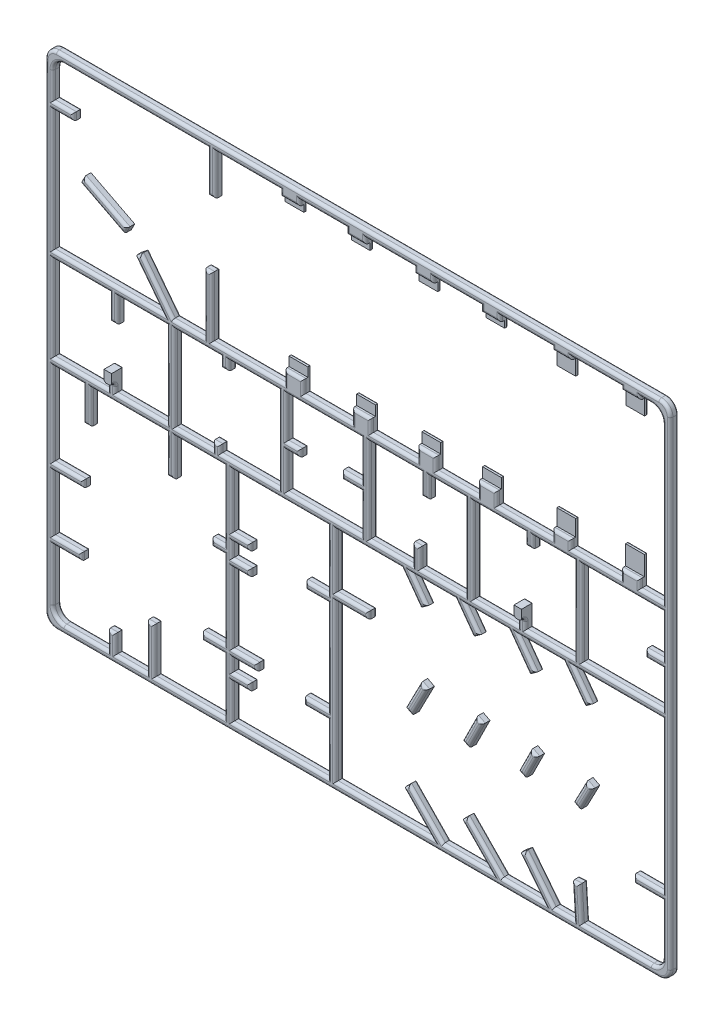
from build123d import *

# Parameters (mm, degrees)
BOSS_EXTRUDE1_DEPTH   = 2
BOSS_EXTRUDE1_2_DEPTH = 2
BOSS_EXTRUDE1_3_DEPTH = 2
BOSS_EXTRUDE1_4_DEPTH = 2
BOSS_EXTRUDE1_5_DEPTH = 2
BOSS_EXTRUDE1_6_DEPTH = 2
CUT_EXTRUDE1_START    = 0.75
CUT_EXTRUDE1_DEPTH    = 10
SKETCH5_W             = 2
SKETCH5_H             = 2.940715199
SKETCH5_H_2           = 2.796627911
BOSS_EXTRUDE2_DEPTH   = 1
FILLET1_R             = 0.75
FILLET2_R             = 0.75
FILLET3_R             = 0.75
FILLET4_R             = 0.75
FILLET5_R             = 0.75
FILLET6_R             = 0.75
FILLET7_R             = 0.25


with BuildPart() as part:
    # Sketch3 → Boss-Extrude1 (new body)
    with BuildSketch(Plane.XY):
        with BuildLine():
            ThreePointArc((-83.519314712, -63.573459525), (-82.640635056, -65.694779868), (-80.519314712, -66.573459525))
            Line((-80.519314712, -66.573459525), (79.897780038, -66.573459525))
            ThreePointArc((79.897780038, -66.573459525), (82.019100381, -65.694779868), (82.897780038, -63.573459525))
            Line((82.897780038, -63.573459525), (82.897780038, 63.862333267))
            ThreePointArc((82.897780038, 63.862333267), (82.019100381, 65.983653611), (79.897780038, 66.862333267))
            Line((79.897780038, 66.862333267), (-80.519314712, 66.862333267))
            ThreePointArc((-80.519314712, 66.862333267), (-82.640635056, 65.983653611), (-83.519314712, 63.862333267))
            Line((-83.519314712, 63.862333267), (-83.519314712, -63.573459525))
        make_face()
        with BuildLine():
            Line((-54.507957135, -52.420022945), (-56.507957135, -52.420022945))
            Line((-56.507957135, -52.420022945), (-56.507957135, -64.573459525))
            Line((-56.507957135, -64.573459525), (-64.876059545, -64.573459525))
            Line((-64.876059545, -64.573459525), (-64.876059545, -59.650746196))
            Line((-64.876059545, -59.650746196), (-66.876059545, -59.650746196))
            Line((-66.876059545, -59.650746196), (-66.876059545, -64.573459525))
            Line((-66.876059545, -64.573459525), (-78.519314712, -64.573459525))
            ThreePointArc((-78.519314712, -64.573459525), (-80.640635056, -63.694779868), (-81.519314712, -61.573459525))
            Line((-81.519314712, -61.573459525), (-81.519314712, -47.458136848))
            Line((-81.519314712, -47.458136848), (-73.814974905, -47.458136848))
            Line((-73.814974905, -47.458136848), (-73.814974905, -45.458136848))
            Line((-73.814974905, -45.458136848), (-81.519314712, -45.458136848))
            Line((-81.519314712, -45.458136848), (-81.519314712, -30.419586985))
            Line((-81.519314712, -30.419586985), (-73.273132618, -30.419586985))
            Line((-73.273132618, -30.419586985), (-73.273132618, -28.419586985))
            Line((-73.273132618, -28.419586985), (-81.519314712, -28.419586985))
            Line((-81.519314712, -28.419586985), (-81.519314712, -6.240984201))
            Line((-81.519314712, -6.240984201), (-73.438463762, -6.240984201))
            Line((-73.438463762, -6.240984201), (-73.438463762, -15.316604107))
            Line((-73.438463762, -15.316604107), (-71.438463762, -15.316604107))
            Line((-71.438463762, -15.316604107), (-71.438463762, -6.240984201))
            Line((-71.438463762, -6.240984201), (-51.104480356, -6.240984201))
            Line((-51.104480356, -6.240984201), (-51.104480356, -16.319749867))
            Line((-51.104480356, -16.319749867), (-49.104480356, -16.319749867))
            Line((-49.104480356, -16.319749867), (-49.104480356, -6.240984201))
            Line((-49.104480356, -6.240984201), (-35.828838226, -6.240984201))
            Line((-35.828838226, -6.240984201), (-35.828838226, -24.711833144))
            Line((-35.828838226, -24.711833144), (-39.262713101, -24.711833144))
            Line((-39.262713101, -24.711833144), (-39.262713101, -26.711833144))
            Line((-39.262713101, -26.711833144), (-35.828838226, -26.711833144))
            Line((-35.828838226, -26.711833144), (-35.828838226, -47.676363199))
            Line((-35.828838226, -47.676363199), (-41.871948211, -47.676363199))
            Line((-41.871948211, -47.676363199), (-41.871948211, -49.676363199))
            Line((-41.871948211, -49.676363199), (-35.828838226, -49.676363199))
            Line((-35.828838226, -49.676363199), (-35.828838226, -64.573459525))
            Line((-35.828838226, -64.573459525), (-54.507957135, -64.573459525))
            Line((-54.507957135, -64.573459525), (-54.507957135, -52.420022945))
        make_face(mode=Mode.SUBTRACT)
        Polygon((-8.23833454, -64.573459525), (-33.828838226, -64.573459525), (-33.828838226, -55.141054483), (-28.941278367, -55.141054483), (-28.941278367, -53.141054483), (-33.828838226, -53.141054483), (-33.828838226, -49.676363199), (-27.104325563, -49.676363199), (-27.104325563, -47.676363199), (-33.828838226, -47.676363199), (-33.828838226, -28.813247753), (-28.941278367, -28.813247753), (-28.941278367, -26.813247753), (-33.828838226, -26.813247753), (-33.828838226, -22.886466611), (-28.941278367, -22.886466611), (-28.941278367, -20.886466611), (-33.828838226, -20.886466611), (-33.828838226, -6.240984201), (-8.23833454, -6.240984201), (-8.23833454, -22.107891293), (-14.256524836, -22.107891293), (-14.256524836, -24.107891293), (-8.23833454, -24.107891293), (-8.23833454, -49.053005999), (-14.605599143, -49.053005999), (-14.605599143, -51.053005999), (-8.23833454, -51.053005999), align=None, mode=Mode.SUBTRACT)
        with BuildLine():
            Line((73.172328231, -46.173106445), (73.172328231, -48.173106445))
            Line((73.172328231, -48.173106445), (80.897780038, -48.173106445))
            Line((80.897780038, -48.173106445), (80.897780038, -61.573459525))
            ThreePointArc((80.897780038, -61.573459525), (80.019100381, -63.694779868), (77.897780038, -64.573459525))
            Line((77.897780038, -64.573459525), (59.305896037, -64.573459525))
            Line((59.305896037, -64.573459525), (58.742326061, -55.715397293))
            Line((58.742326061, -55.715397293), (56.746361606, -55.842385071))
            Line((56.746361606, -55.842385071), (57.301852333, -64.573459525))
            Line((57.301852333, -64.573459525), (51.809111543, -64.573459525))
            Line((51.809111543, -64.573459525), (44.409070671, -55.160841787))
            Line((44.409070671, -55.160841787), (42.83679214, -56.396940577))
            Line((42.83679214, -56.396940577), (49.265033049, -64.573459525))
            Line((49.265033049, -64.573459525), (38.048947985, -64.573459525))
            Line((38.048947985, -64.573459525), (28.790850061, -55.080688737))
            Line((28.790850061, -55.080688737), (27.359049312, -56.477093627))
            Line((27.359049312, -56.477093627), (35.255263177, -64.573459525))
            Line((35.255263177, -64.573459525), (22.301143858, -64.573459525))
            Line((22.301143858, -64.573459525), (13.331953039, -55.376919015))
            Line((13.331953039, -55.376919015), (11.90015229, -56.773323904))
            Line((11.90015229, -56.773323904), (19.507459051, -64.573459525))
            Line((19.507459051, -64.573459525), (-6.23833454, -64.573459525))
            Line((-6.23833454, -64.573459525), (-6.23833454, -22.886466611))
            Line((-6.23833454, -22.886466611), (2.517730657, -22.886466611))
            Line((2.517730657, -22.886466611), (2.517730657, -20.886466611))
            Line((2.517730657, -20.886466611), (-6.23833454, -20.886466611))
            Line((-6.23833454, -20.886466611), (-6.23833454, -6.240984201))
            Line((-6.23833454, -6.240984201), (11.418024461, -6.240984201))
            Line((11.418024461, -6.240984201), (16.415870407, -13.123531529))
            Line((16.415870407, -13.123531529), (18.034197004, -11.948363871))
            Line((18.034197004, -11.948363871), (13.88971343, -6.240984201))
            Line((13.88971343, -6.240984201), (25.688198823, -6.240984201))
            Line((25.688198823, -6.240984201), (30.443837347, -12.789987024))
            Line((30.443837347, -12.789987024), (32.062163944, -11.614819366))
            Line((32.062163944, -11.614819366), (28.159887793, -6.240984201))
            Line((28.159887793, -6.240984201), (39.848961122, -6.240984201))
            Line((39.848961122, -6.240984201), (45.4438614, -13.945736683))
            Line((45.4438614, -13.945736683), (47.062187998, -12.770569025))
            Line((47.062187998, -12.770569025), (42.320650091, -6.240984201))
            Line((42.320650091, -6.240984201), (54.506593956, -6.240984201))
            Line((54.506593956, -6.240984201), (60.15216236, -13.949039604))
            Line((60.15216236, -13.949039604), (61.765671392, -12.767266104))
            Line((61.765671392, -12.767266104), (56.985662819, -6.240984201))
            Line((56.985662819, -6.240984201), (80.897780038, -6.240984201))
            Line((80.897780038, -6.240984201), (80.897780038, -46.173106445))
            Line((80.897780038, -46.173106445), (73.172328231, -46.173106445))
        make_face(mode=Mode.SUBTRACT)
        Polygon((-66.352374221, 11.740312755), (-64.352374221, 11.740312755), (-64.352374221, 18.457447133), (-51.104480356, 18.457447133), (-51.104480356, -4.240984201), (-64.876059545, -4.240984201), (-64.876059545, 0.871466259), (-66.876059545, 0.871466259), (-66.876059545, -4.240984201), (-81.519314712, -4.240984201), (-81.519314712, 18.457447133), (-66.352374221, 18.457447133), align=None, mode=Mode.SUBTRACT)
        Polygon((-36.769306967, 18.457447133), (-36.769306967, 15.795175965), (-34.769306967, 15.795175965), (-34.769306967, 18.457447133), (-21.352881347, 18.457447133), (-21.352881347, -4.240984201), (-36.949642774, -4.240984201), (-36.949642774, -2.200002897), (-38.949642774, -2.200002897), (-38.949642774, -4.240984201), (-49.104480356, -4.240984201), (-49.104480356, 18.457447133), align=None, mode=Mode.SUBTRACT)
        Polygon((0.670333987, -4.240984201), (-19.352881347, -4.240984201), (-19.352881347, 5.409946313), (-15.671871189, 5.409946313), (-15.671871189, 7.409946313), (-19.352881347, 7.409946313), (-19.352881347, 18.457447133), (0.670333987, 18.457447133), (0.670333987, 8.108231466), (-4.567004912, 8.108231466), (-4.567004912, 6.108231466), (0.670333987, 6.108231466), align=None, mode=Mode.SUBTRACT)
        Polygon((14.291240949, -4.240984201), (2.670333987, -4.240984201), (2.670333987, 18.457447133), (16.591546265, 18.457447133), (16.591546265, 12.890249838), (18.591546265, 12.890249838), (18.591546265, 18.457447133), (28.363232015, 18.457447133), (28.363232015, -4.240984201), (16.291240949, -4.240984201), (16.291240949, 0.871466259), (14.291240949, 0.871466259), align=None, mode=Mode.SUBTRACT)
        Polygon((44.356571704, 18.457447133), (44.356571704, 15.341646321), (46.356571704, 15.341646321), (46.356571704, 18.457447133), (57.367496449, 18.457447133), (57.367496449, -4.240984201), (44.305864114, -4.240984201), (44.305864114, 1.11186894), (42.305864114, 1.11186894), (42.305864114, -4.240984201), (30.363232015, -4.240984201), (30.363232015, 18.457447133), align=None, mode=Mode.SUBTRACT)
        Polygon((80.897780038, 5.409946313), (80.897780038, -4.240984201), (59.367496449, -4.240984201), (59.367496449, 18.457447133), (80.897780038, 18.457447133), (80.897780038, 7.409946313), (76.343280176, 7.409946313), (76.343280176, 5.409946313), align=None, mode=Mode.SUBTRACT)
        with BuildLine():
            Line((80.897780038, 61.862333267), (80.897780038, 20.457447133))
            Line((80.897780038, 20.457447133), (74.790620634, 20.457447133))
            Line((74.790620634, 20.457447133), (74.790620634, 27.861226693))
            Line((74.790620634, 27.861226693), (69.790620634, 27.861226693))
            Line((69.790620634, 27.861226693), (69.790620634, 20.457447133))
            Line((69.790620634, 20.457447133), (56.490178798, 20.457447133))
            Line((56.490178798, 20.457447133), (56.490178798, 27.012376091))
            Line((56.490178798, 27.012376091), (51.490178798, 27.012376091))
            Line((51.490178798, 27.012376091), (51.490178798, 20.457447133))
            Line((51.490178798, 20.457447133), (36.687493252, 20.457447133))
            Line((36.687493252, 20.457447133), (36.687493252, 26.561417494))
            Line((36.687493252, 26.561417494), (31.687493252, 26.561417494))
            Line((31.687493252, 26.561417494), (31.687493252, 20.457447133))
            Line((31.687493252, 20.457447133), (20.555720119, 20.457447133))
            Line((20.555720119, 20.457447133), (20.555720119, 26.561417494))
            Line((20.555720119, 26.561417494), (15.555720119, 26.561417494))
            Line((15.555720119, 26.561417494), (15.555720119, 20.457447133))
            Line((15.555720119, 20.457447133), (3.174810137, 20.457447133))
            Line((3.174810137, 20.457447133), (3.174810137, 26.561417494))
            Line((3.174810137, 26.561417494), (-1.825189863, 26.561417494))
            Line((-1.825189863, 26.561417494), (-1.825189863, 20.457447133))
            Line((-1.825189863, 20.457447133), (-14.827882291, 20.457447133))
            Line((-14.827882291, 20.457447133), (-14.827882291, 26.315097408))
            Line((-14.827882291, 26.315097408), (-19.827882291, 26.315097408))
            Line((-19.827882291, 26.315097408), (-19.827882291, 20.457447133))
            Line((-19.827882291, 20.457447133), (-39.165803603, 20.457447133))
            Line((-39.165803603, 20.457447133), (-39.165803603, 36.417121741))
            Line((-39.165803603, 36.417121741), (-41.165803603, 36.417121741))
            Line((-41.165803603, 36.417121741), (-41.165803603, 20.457447133))
            Line((-41.165803603, 20.457447133), (-49.613507595, 20.457447133))
            Line((-49.613507595, 20.457447133), (-58.037306471, 31.356396888))
            Line((-58.037306471, 31.356396888), (-59.619744177, 30.133330697))
            Line((-59.619744177, 30.133330697), (-52.141253228, 20.457447133))
            Line((-52.141253228, 20.457447133), (-81.519314712, 20.457447133))
            Line((-81.519314712, 20.457447133), (-81.519314712, 52.854637304))
            Line((-81.519314712, 52.854637304), (-75.982827986, 52.854637304))
            Line((-75.982827986, 52.854637304), (-75.982827986, 54.854637304))
            Line((-75.982827986, 54.854637304), (-81.519314712, 54.854637304))
            Line((-81.519314712, 54.854637304), (-81.519314712, 61.862333267))
            ThreePointArc((-81.519314712, 61.862333267), (-80.640635056, 63.983653611), (-78.519314712, 64.862333267))
            Line((-78.519314712, 64.862333267), (-40.262713101, 64.862333267))
            Line((-40.262713101, 64.862333267), (-40.262713101, 53.854637304))
            Line((-40.262713101, 53.854637304), (-38.262713101, 53.854637304))
            Line((-38.262713101, 53.854637304), (-38.262713101, 64.862333267))
            Line((-38.262713101, 64.862333267), (-20.89451971, 64.862333267))
            Line((-20.89451971, 64.862333267), (-20.89451971, 61.429375725))
            Line((-20.89451971, 61.429375725), (-15.89451971, 61.429375725))
            Line((-15.89451971, 61.429375725), (-15.89451971, 64.862333267))
            Line((-15.89451971, 64.862333267), (-3.273128242, 64.862333267))
            Line((-3.273128242, 64.862333267), (-3.273128242, 61.429375725))
            Line((-3.273128242, 61.429375725), (1.726871758, 61.429375725))
            Line((1.726871758, 61.429375725), (1.726871758, 64.862333267))
            Line((1.726871758, 64.862333267), (14.767820166, 64.862333267))
            Line((14.767820166, 64.862333267), (14.767820166, 60.957225524))
            Line((14.767820166, 60.957225524), (19.767820166, 60.957225524))
            Line((19.767820166, 60.957225524), (19.767820166, 64.862333267))
            Line((19.767820166, 64.862333267), (32.548978708, 64.862333267))
            Line((32.548978708, 64.862333267), (32.548978708, 61.429375725))
            Line((32.548978708, 61.429375725), (37.548978708, 61.429375725))
            Line((37.548978708, 61.429375725), (37.548978708, 64.862333267))
            Line((37.548978708, 64.862333267), (51.490178798, 64.862333267))
            Line((51.490178798, 64.862333267), (51.490178798, 59.824189276))
            Line((51.490178798, 59.824189276), (56.490178798, 59.824189276))
            Line((56.490178798, 59.824189276), (56.490178798, 64.862333267))
            Line((56.490178798, 64.862333267), (69.853511767, 64.862333267))
            Line((69.853511767, 64.862333267), (69.853511767, 59.824189276))
            Line((69.853511767, 59.824189276), (74.853511767, 59.824189276))
            Line((74.853511767, 59.824189276), (74.853511767, 64.862333267))
            Line((74.853511767, 64.862333267), (77.897780038, 64.862333267))
            ThreePointArc((77.897780038, 64.862333267), (80.019100381, 63.983653611), (80.897780038, 61.862333267))
        make_face(mode=Mode.SUBTRACT)
    extrude(amount=BOSS_EXTRUDE1_DEPTH)

    # Sketch4 → Cut-Extrude1 (cut)
    with BuildSketch(Plane.XY.offset(CUT_EXTRUDE1_START)):
        Polygon((44.141484857, 63.255744086), (44.141484857, 63.946982285), (79.151088229, 63.946982285), (79.151088229, 22.73298783), (44.141484857, 22.73298783), (44.141484857, 23.914632256), (-26.70772101, 23.914632256), (-26.70772101, 63.255744086), align=None)
    extrude(amount=CUT_EXTRUDE1_DEPTH, mode=Mode.SUBTRACT)

    # Sketch5 → Boss-Extrude2 (add)
    with BuildSketch(Plane.XY.offset(2)):
        with Locations((-65.876059545, -0.598891341)):
            Rectangle(SKETCH5_W, SKETCH5_H)
        with Locations((43.305864114, -0.286445016)):
            Rectangle(SKETCH5_W, SKETCH5_H_2)
    extrude(amount=BOSS_EXTRUDE2_DEPTH)

    # Fillet1
    fillet1_edges = [part.edges().sort_by_distance(p)[0] for p in [
        (48.413622024, -6.240984201, 2),
        (57.329378158, -10.095011903, 2),
        (60.958916876, -13.358152854, 2),
        (59.375667105, -9.504125153, 2),
        (68.941721428, -6.240984201, 2),
        (-35.769306967, 15.795175965, 2),
        (80.897780038, -26.207045323, 2),
        (77.035054134, -46.173106445, 2),
        (73.172328231, -47.173106445, 2),
        (77.035054134, -48.173106445, 2),
        (-34.769306967, 17.126311549, 2),
        (-28.061094157, 18.457447133, 2),
        (-21.352881347, 7.108231466, 2),
        (-29.15126206, -4.240984201, 2),
        (-36.949642774, -3.220493549, 2),
        (-37.949642774, -2.200002897, 2),
        (-38.949642774, -3.220493549, 2),
        (-44.027061565, -4.240984201, 2),
        (-49.104480356, 7.108231466, 2),
        (82.897780038, 0.144436871, 2),
        (36.334548065, -4.240984201, 2),
        (30.363232015, 7.108231466, 2),
        (37.359901859, 18.457447133, 2),
        (44.356571704, 16.899546727, 2),
        (45.356571704, 15.341646321, 2),
        (46.356571704, 16.899546727, 2),
        (51.862034077, 18.457447133, 2),
        (57.367496449, 7.108231466, 2),
        (82.019100381, 65.983653611, 2),
        (50.836680282, -4.240984201, 2),
        (80.897780038, 0.584481056, 2),
        (70.132638244, -4.240984201, 2),
        (59.367496449, 7.108231466, 2),
        (70.132638244, 18.457447133, 2),
        (80.897780038, 12.933696723, 2),
        (78.620530107, 7.409946313, 2),
        (76.343280176, 6.409946313, 2),
        (78.620530107, 5.409946313, 2),
        (-0.310767337, 66.862333267, 2),
        (-66.876059545, -3.15511657, 2),
        (-74.197687129, -4.240984201, 2),
        (-81.519314712, 7.108231466, 2),
        (-73.935844467, 18.457447133, 2),
        (-66.352374221, 15.098879944, 2),
        (-65.352374221, 11.740312755, 2),
        (-64.352374221, 15.098879944, 2),
        (-57.728427288, 18.457447133, 2),
        (-51.104480356, 7.108231466, 2),
        (-57.99026995, -4.240984201, 2),
        (-82.640635056, 65.983653611, 2),
        (-64.876059545, -3.15511657, 2),
        (14.291240949, -1.684758971, 2),
        (8.480787468, -4.240984201, 2),
        (2.670333987, 7.108231466, 2),
        (9.630940126, 18.457447133, 2),
        (16.591546265, 15.673848486, 2),
        (17.591546265, 12.890249838, 2),
        (18.591546265, 15.673848486, 2),
        (23.47738914, 18.457447133, 2),
        (-83.519314712, 0.144436871, 2),
        (28.363232015, 7.108231466, 2),
        (22.327236482, -4.240984201, 2),
        (16.291240949, -1.684758971, 2),
        (15.291240949, 0.871466259, 2),
        (-31.385058296, -20.886466611, 2),
        (-33.828838226, -13.563725406, 2),
        (-21.033586383, -6.240984201, 2),
        (-8.23833454, -14.174437747, 2),
        (-11.247429688, -22.107891293, 2),
        (-14.256524836, -23.107891293, 2),
        (-82.640635056, -65.694779868, 2),
        (-11.247429688, -24.107891293, 2),
        (-8.23833454, -36.580448646, 2),
        (-11.421966841, -49.053005999, 2),
        (-14.605599143, -50.053005999, 2),
        (-11.421966841, -51.053005999, 2),
        (-8.23833454, -57.813232762, 2),
        (-21.033586383, -64.573459525, 2),
        (-33.828838226, -59.857257004, 2),
        (-31.385058296, -55.141054483, 2),
        (-28.941278367, -54.141054483, 2),
        (-0.310767337, -66.573459525, 2),
        (-31.385058296, -53.141054483, 2),
        (-33.828838226, -51.408708841, 2),
        (-30.466581895, -49.676363199, 2),
        (-27.104325563, -48.676363199, 2),
        (-30.466581895, -47.676363199, 2),
        (-33.828838226, -38.244805476, 2),
        (-31.385058296, -28.813247753, 2),
        (-28.941278367, -27.813247753, 2),
        (-31.385058296, -26.813247753, 2),
        (-33.828838226, -24.849857182, 2),
        (82.019100381, -65.694779868, 2),
        (-31.385058296, -22.886466611, 2),
        (-28.941278367, -21.886466611, 2),
        (-72.697687129, -64.573459525, 2),
        (-80.640635056, -63.694779868, 2),
        (-81.519314712, -54.515798186, 2),
        (-77.667144809, -47.458136848, 2),
        (-73.814974905, -46.458136848, 2),
        (-77.667144809, -45.458136848, 2),
        (-81.519314712, -37.938861917, 2),
        (-77.396223665, -30.419586985, 2),
        (0.670333987, 13.2828393, 2),
        (-73.273132618, -29.419586985, 2),
        (-77.396223665, -28.419586985, 2),
        (-81.519314712, -17.330285593, 2),
        (-77.478889237, -6.240984201, 2),
        (-73.438463762, -10.778794154, 2),
        (-72.438463762, -15.316604107, 2),
        (-71.438463762, -10.778794154, 2),
        (-61.271472059, -6.240984201, 2),
        (-51.104480356, -11.280367034, 2),
        (-50.104480356, -16.319749867, 2),
        (-1.948335463, 8.108231466, 2),
        (-49.104480356, -11.280367034, 2),
        (-42.466659291, -6.240984201, 2),
        (-35.828838226, -15.476408672, 2),
        (-37.545775664, -24.711833144, 2),
        (-39.262713101, -25.711833144, 2),
        (-37.545775664, -26.711833144, 2),
        (-35.828838226, -37.194098171, 2),
        (-38.850393218, -47.676363199, 2),
        (-41.871948211, -48.676363199, 2),
        (-38.850393218, -49.676363199, 2),
        (-4.567004912, 7.108231466, 2),
        (-35.828838226, -57.124911362, 2),
        (-45.16839768, -64.573459525, 2),
        (-54.507957135, -58.496741235, 2),
        (-55.507957135, -52.420022945, 2),
        (-56.507957135, -58.496741235, 2),
        (-60.69200834, -64.573459525, 2),
        (-64.876059545, -62.11210286, 2),
        (-65.876059545, -59.650746196, 2),
        (-66.876059545, -62.11210286, 2),
        (80.019100381, 63.983653611, 2),
        (-1.948335463, 6.108231466, 2),
        (80.897780038, 41.1598902, 2),
        (77.844200336, 20.457447133, 2),
        (63.140399716, 20.457447133, 2),
        (56.490178798, 21.595217482, 2),
        (51.490178798, 21.595217482, 2),
        (44.088836025, 20.457447133, 2),
        (0.670333987, 0.933623632, 2),
        (26.121606685, 20.457447133, 2),
        (9.365265128, 20.457447133, 2),
        (-9.34127368, -4.240984201, 2),
        (-8.326536077, 20.457447133, 2),
        (-29.496842947, 20.457447133, 2),
        (-39.165803603, 28.437284437, 2),
        (-40.165803603, 36.417121741, 2),
        (-41.165803603, 28.437284437, 2),
        (-45.389655599, 20.457447133, 2),
        (-19.352881347, 0.584481056, 2),
        (74.790620634, 21.595217482, 2),
        (69.790620634, 21.595217482, 2),
        (36.687493252, 22.186039695, 2),
        (31.687493252, 22.186039695, 2),
        (20.555720119, 22.186039695, 2),
        (15.555720119, 22.186039695, 2),
        (3.174810137, 22.186039695, 2),
        (-1.825189863, 22.186039695, 2),
        (-53.825407033, 25.906922011, 2),
        (-14.827882291, 22.186039695, 2),
        (-19.827882291, 22.186039695, 2),
        (-20.89451971, 64.059038676, 2),
        (-15.89451971, 64.059038676, 2),
        (-3.273128242, 64.059038676, 2),
        (1.726871758, 64.059038676, 2),
        (14.767820166, 64.059038676, 2),
        (19.767820166, 64.059038676, 2),
        (32.548978708, 64.059038676, 2),
        (37.548978708, 64.059038676, 2),
        (51.490178798, 64.404657776, 2),
        (56.490178798, 64.404657776, 2),
        (69.853511767, 64.404657776, 2),
        (74.853511767, 64.404657776, 2),
        (-58.828525324, 30.744863792, 2),
        (35.048978708, 63.255744086, 2),
        (17.267820166, 63.255744086, 2),
        (-0.773128242, 63.255744086, 2),
        (-18.39451971, 63.255744086, 2),
        (72.353511767, 63.946982285, 2),
        (53.990178798, 63.946982285, 2),
        (53.990178798, 22.73298783, 2),
        (72.290620634, 22.73298783, 2),
        (-17.327882291, 23.914632256, 2),
        (-55.880498702, 25.295388915, 2),
        (0.674810137, 23.914632256, 2),
        (18.055720119, 23.914632256, 2),
        (34.187493252, 23.914632256, 2),
        (-66.83028397, 20.457447133, 2),
        (-81.519314712, 36.656042219, 2),
        (-78.751071349, 52.854637304, 2),
        (-75.982827986, 53.854637304, 2),
        (-78.751071349, 54.854637304, 2),
        (-81.519314712, 58.358485286, 2),
        (-80.640635056, 63.983653611, 2),
        (-17.512376268, 5.409946313, 2),
        (-59.391013907, 64.862333267, 2),
        (-40.262713101, 59.358485286, 2),
        (-39.262713101, 53.854637304, 2),
        (-38.262713101, 59.358485286, 2),
        (-29.578616405, 64.862333267, 2),
        (-9.583823976, 64.862333267, 2),
        (-15.671871189, 6.409946313, 2),
        (8.247345962, 64.862333267, 2),
        (26.158399437, 64.862333267, 2),
        (-17.512376268, 7.409946313, 2),
        (-64.876059545, -2.06924894, 2.5),
        (44.519578753, 64.862333267, 2),
        (-65.876059545, -2.06924894, 2),
        (-66.876059545, -2.06924894, 2.5),
        (44.305864114, -2.962871586, 2),
        (42.305864114, -2.962871586, 2),
        (43.305864114, -1.684758971, 2),
        (42.305864114, -1.684758971, 2.5),
        (44.305864114, -1.684758971, 2.5),
        (63.171845282, 64.862333267, 2),
        (76.375645902, 64.862333267, 2),
        (80.897780038, -54.873282985, 2),
        (-19.352881347, 12.933696723, 2),
        (80.019100381, -63.694779868, 2),
        (68.601838038, -64.573459525, 2),
        (59.024111049, -60.144428409, 2),
        (57.744343834, -55.778891182, 2),
        (57.02410697, -60.207922298, 2),
        (54.555481938, -64.573459525, 2),
        (48.109091107, -59.867150656, 2),
        (43.622931406, -55.778891182, 2),
        (46.050912594, -60.485200051, 2),
        (43.656990517, -64.573459525, 2),
        (-9.34127368, 18.457447133, 2),
        (33.419899023, -59.827074131, 2),
        (28.074949687, -55.778891182, 2),
        (31.307156245, -60.525276576, 2),
        (28.778203518, -64.573459525, 2),
        (17.816548449, -59.97518927, 2),
        (12.616052664, -56.075121459, 2),
        (15.70380567, -60.673391714, 2),
        (6.634562255, -64.573459525, 2),
        (-6.23833454, -43.729963068, 2),
        (-1.860301942, -22.886466611, 2),
        (-42.936893661, 18.457447133, 2),
        (2.517730657, -21.886466611, 2),
        (-1.860301942, -20.886466611, 2),
        (-6.23833454, -13.563725406, 2),
        (2.58984496, -6.240984201, 2),
        (13.916947434, -9.682257865, 2),
        (17.225033706, -12.5359477, 2),
        (15.961955217, -9.094674036, 2),
        (19.788956127, -6.240984201, 2),
        (28.066018085, -9.515485613, 2),
        (31.253000645, -12.202403195, 2),
        (-36.769306967, 17.126311549, 2),
        (30.111025868, -8.927901784, 2),
        (34.004424457, -6.240984201, 2),
        (42.646411261, -10.093360442, 2),
        (46.253024699, -13.358152854, 2),
        (44.691419045, -9.505776613, 2),
    ]]
    fillet(fillet1_edges, radius=FILLET1_R)

    # Fillet7
    fillet7_edges = [part.edges().sort_by_distance(p)[0] for p in [
        (77.035054134, -48.173106445, 0),
        (73.172328231, -47.173106445, 0),
        (77.035054134, -46.173106445, 0),
        (80.897780038, -26.207045323, 0),
        (68.941721428, -6.240984201, 0),
        (59.375667105, -9.504125153, 0),
        (60.958916876, -13.358152854, 0),
        (57.329378158, -10.095011903, 0),
        (48.413622024, -6.240984201, 0),
        (44.691419045, -9.505776613, 0),
        (46.253024699, -13.358152854, 0),
        (42.646411261, -10.093360442, 0),
        (34.004424457, -6.240984201, 0),
        (30.111025868, -8.927901784, 0),
        (31.253000645, -12.202403195, 0),
        (28.066018085, -9.515485613, 0),
        (19.788956127, -6.240984201, 0),
        (15.961955217, -9.094674036, 0),
        (17.225033706, -12.5359477, 0),
        (13.916947434, -9.682257865, 0),
        (2.58984496, -6.240984201, 0),
        (-6.23833454, -13.563725406, 0),
        (-1.860301942, -20.886466611, 0),
        (2.517730657, -21.886466611, 0),
        (-1.860301942, -22.886466611, 0),
        (-6.23833454, -43.729963068, 0),
        (6.634562255, -64.573459525, 0),
        (15.70380567, -60.673391714, 0),
        (12.616052664, -56.075121459, 0),
        (17.816548449, -59.97518927, 0),
        (28.778203518, -64.573459525, 0),
        (31.307156245, -60.525276576, 0),
        (28.074949687, -55.778891182, 0),
        (33.419899023, -59.827074131, 0),
        (43.656990517, -64.573459525, 0),
        (46.050912594, -60.485200051, 0),
        (43.622931406, -55.778891182, 0),
        (48.109091107, -59.867150656, 0),
        (54.555481938, -64.573459525, 0),
        (57.02410697, -60.207922298, 0),
        (57.744343834, -55.778891182, 0),
        (59.024111049, -60.144428409, 0),
        (68.601838038, -64.573459525, 0),
        (80.019100381, -63.694779868, 0),
        (80.897780038, -54.873282985, 0),
        (76.375645902, 64.862333267, 0),
        (74.853511767, 62.343261272, 0),
        (72.353511767, 59.824189276, 0),
        (69.853511767, 62.343261272, 0),
        (63.171845282, 64.862333267, 0),
        (56.490178798, 62.343261272, 0),
        (53.990178798, 59.824189276, 0),
        (51.490178798, 62.343261272, 0),
        (44.519578753, 64.862333267, 0),
        (37.548978708, 63.145854496, 0),
        (35.048978708, 61.429375725, 0),
        (32.548978708, 63.145854496, 0),
        (26.158399437, 64.862333267, 0),
        (19.767820166, 62.909779396, 0),
        (17.267820166, 60.957225524, 0),
        (14.767820166, 62.909779396, 0),
        (8.247345962, 64.862333267, 0),
        (1.726871758, 63.145854496, 0),
        (-0.773128242, 61.429375725, 0),
        (-3.273128242, 63.145854496, 0),
        (-9.583823976, 64.862333267, 0),
        (-15.89451971, 63.145854496, 0),
        (-18.39451971, 61.429375725, 0),
        (-20.89451971, 63.145854496, 0),
        (-29.578616405, 64.862333267, 0),
        (-38.262713101, 59.358485286, 0),
        (-39.262713101, 53.854637304, 0),
        (-40.262713101, 59.358485286, 0),
        (-59.391013907, 64.862333267, 0),
        (-80.640635056, 63.983653611, 0),
        (-81.519314712, 58.358485286, 0),
        (-78.751071349, 54.854637304, 0),
        (-75.982827986, 53.854637304, 0),
        (-78.751071349, 52.854637304, 0),
        (-81.519314712, 36.656042219, 0),
        (-66.83028397, 20.457447133, 0),
        (-55.880498702, 25.295388915, 0),
        (-58.828525324, 30.744863792, 0),
        (-53.825407033, 25.906922011, 0),
        (-45.389655599, 20.457447133, 0),
        (-41.165803603, 28.437284437, 0),
        (-40.165803603, 36.417121741, 0),
        (-39.165803603, 28.437284437, 0),
        (-29.496842947, 20.457447133, 0),
        (-19.827882291, 23.386272271, 0),
        (-17.327882291, 26.315097408, 0),
        (-14.827882291, 23.386272271, 0),
        (-8.326536077, 20.457447133, 0),
        (-1.825189863, 23.509432314, 0),
        (0.674810137, 26.561417494, 0),
        (3.174810137, 23.509432314, 0),
        (9.365265128, 20.457447133, 0),
        (15.555720119, 23.509432314, 0),
        (18.055720119, 26.561417494, 0),
        (20.555720119, 23.509432314, 0),
        (26.121606685, 20.457447133, 0),
        (31.687493252, 23.509432314, 0),
        (34.187493252, 26.561417494, 0),
        (36.687493252, 23.509432314, 0),
        (44.088836025, 20.457447133, 0),
        (51.490178798, 23.734911612, 0),
        (53.990178798, 27.012376091, 0),
        (56.490178798, 23.734911612, 0),
        (63.140399716, 20.457447133, 0),
        (69.790620634, 24.159336913, 0),
        (72.290620634, 27.861226693, 0),
        (74.790620634, 24.159336913, 0),
        (77.844200336, 20.457447133, 0),
        (80.897780038, 41.1598902, 0),
        (80.019100381, 63.983653611, 0),
        (-66.876059545, -62.11210286, 0),
        (-65.876059545, -59.650746196, 0),
        (-64.876059545, -62.11210286, 0),
        (-60.69200834, -64.573459525, 0),
        (-56.507957135, -58.496741235, 0),
        (-55.507957135, -52.420022945, 0),
        (-54.507957135, -58.496741235, 0),
        (-45.16839768, -64.573459525, 0),
        (-35.828838226, -57.124911362, 0),
        (-38.850393218, -49.676363199, 0),
        (-41.871948211, -48.676363199, 0),
        (-38.850393218, -47.676363199, 0),
        (-35.828838226, -37.194098171, 0),
        (-37.545775664, -26.711833144, 0),
        (-39.262713101, -25.711833144, 0),
        (-37.545775664, -24.711833144, 0),
        (-35.828838226, -15.476408672, 0),
        (-42.466659291, -6.240984201, 0),
        (-49.104480356, -11.280367034, 0),
        (-50.104480356, -16.319749867, 0),
        (-51.104480356, -11.280367034, 0),
        (-61.271472059, -6.240984201, 0),
        (-71.438463762, -10.778794154, 0),
        (-72.438463762, -15.316604107, 0),
        (-73.438463762, -10.778794154, 0),
        (-77.478889237, -6.240984201, 0),
        (-81.519314712, -17.330285593, 0),
        (-77.396223665, -28.419586985, 0),
        (-73.273132618, -29.419586985, 0),
        (-77.396223665, -30.419586985, 0),
        (-81.519314712, -37.938861917, 0),
        (-77.667144809, -45.458136848, 0),
        (-73.814974905, -46.458136848, 0),
        (-77.667144809, -47.458136848, 0),
        (-81.519314712, -54.515798186, 0),
        (-80.640635056, -63.694779868, 0),
        (-72.697687129, -64.573459525, 0),
        (-28.941278367, -21.886466611, 0),
        (-31.385058296, -22.886466611, 0),
        (-33.828838226, -24.849857182, 0),
        (-31.385058296, -26.813247753, 0),
        (-28.941278367, -27.813247753, 0),
        (-31.385058296, -28.813247753, 0),
        (-33.828838226, -38.244805476, 0),
        (-30.466581895, -47.676363199, 0),
        (-27.104325563, -48.676363199, 0),
        (-30.466581895, -49.676363199, 0),
        (-33.828838226, -51.408708841, 0),
        (-31.385058296, -53.141054483, 0),
        (-28.941278367, -54.141054483, 0),
        (-31.385058296, -55.141054483, 0),
        (-33.828838226, -59.857257004, 0),
        (-21.033586383, -64.573459525, 0),
        (-8.23833454, -57.813232762, 0),
        (-11.421966841, -51.053005999, 0),
        (-14.605599143, -50.053005999, 0),
        (-11.421966841, -49.053005999, 0),
        (-8.23833454, -36.580448646, 0),
        (-11.247429688, -24.107891293, 0),
        (-14.256524836, -23.107891293, 0),
        (-11.247429688, -22.107891293, 0),
        (-8.23833454, -14.174437747, 0),
        (-21.033586383, -6.240984201, 0),
        (-33.828838226, -13.563725406, 0),
        (-31.385058296, -20.886466611, 0),
        (15.291240949, 0.871466259, 0),
        (16.291240949, -1.684758971, 0),
        (22.327236482, -4.240984201, 0),
        (28.363232015, 7.108231466, 0),
        (23.47738914, 18.457447133, 0),
        (18.591546265, 15.673848486, 0),
        (17.591546265, 12.890249838, 0),
        (16.591546265, 15.673848486, 0),
        (9.630940126, 18.457447133, 0),
        (2.670333987, 7.108231466, 0),
        (8.480787468, -4.240984201, 0),
        (14.291240949, -1.684758971, 0),
        (-65.876059545, 0.871466259, 0),
        (-64.876059545, -1.684758971, 0),
        (-57.99026995, -4.240984201, 0),
        (-51.104480356, 7.108231466, 0),
        (-57.728427288, 18.457447133, 0),
        (-64.352374221, 15.098879944, 0),
        (-65.352374221, 11.740312755, 0),
        (-66.352374221, 15.098879944, 0),
        (-73.935844467, 18.457447133, 0),
        (-81.519314712, 7.108231466, 0),
        (-74.197687129, -4.240984201, 0),
        (-66.876059545, -1.684758971, 0),
        (78.620530107, 5.409946313, 0),
        (76.343280176, 6.409946313, 0),
        (78.620530107, 7.409946313, 0),
        (80.897780038, 12.933696723, 0),
        (70.132638244, 18.457447133, 0),
        (59.367496449, 7.108231466, 0),
        (70.132638244, -4.240984201, 0),
        (80.897780038, 0.584481056, 0),
        (44.305864114, -1.564557631, 0),
        (50.836680282, -4.240984201, 0),
        (57.367496449, 7.108231466, 0),
        (51.862034077, 18.457447133, 0),
        (46.356571704, 16.899546727, 0),
        (45.356571704, 15.341646321, 0),
        (44.356571704, 16.899546727, 0),
        (37.359901859, 18.457447133, 0),
        (30.363232015, 7.108231466, 0),
        (36.334548065, -4.240984201, 0),
        (42.305864114, -1.564557631, 0),
        (43.305864114, 1.11186894, 0),
        (-49.104480356, 7.108231466, 0),
        (-44.027061565, -4.240984201, 0),
        (-38.949642774, -3.220493549, 0),
        (-37.949642774, -2.200002897, 0),
        (-36.949642774, -3.220493549, 0),
        (-29.15126206, -4.240984201, 0),
        (-21.352881347, 7.108231466, 0),
        (-28.061094157, 18.457447133, 0),
        (-34.769306967, 17.126311549, 0),
        (-35.769306967, 15.795175965, 0),
        (-36.769306967, 17.126311549, 0),
        (-42.936893661, 18.457447133, 0),
        (-9.34127368, 18.457447133, 0),
        (-19.352881347, 12.933696723, 0),
        (-17.512376268, 7.409946313, 0),
        (-15.671871189, 6.409946313, 0),
        (-17.512376268, 5.409946313, 0),
        (-19.352881347, 0.584481056, 0),
        (-9.34127368, -4.240984201, 0),
        (0.670333987, 0.933623632, 0),
        (-1.948335463, 6.108231466, 0),
        (-4.567004912, 7.108231466, 0),
        (-1.948335463, 8.108231466, 0),
        (0.670333987, 13.2828393, 0),
        (82.019100381, -65.694779868, 0),
        (-0.310767337, -66.573459525, 0),
        (-82.640635056, -65.694779868, 0),
        (-83.519314712, 0.144436871, 0),
        (-82.640635056, 65.983653611, 0),
        (-0.310767337, 66.862333267, 0),
        (82.019100381, 65.983653611, 0),
        (82.897780038, 0.144436871, 0),
    ]]
    fillet(fillet7_edges, radius=FILLET7_R)


with BuildPart() as body_2:
    # Sketch3 → Boss-Extrude1 2 (new body)
    with BuildSketch(Plane.XY):
        Polygon((12.303548807, -38.117424711), (14.079660405, -39.036896076), (18.113089505, -31.245658113), (16.336977907, -30.326186749), align=None)
    extrude(amount=BOSS_EXTRUDE1_2_DEPTH)

    # Fillet6
    fillet6_edges = [body_2.edges().sort_by_distance(p)[0] for p in [
        (16.096374955, -35.141277095, 2),
        (17.225033706, -30.785922431, 2),
        (14.320263357, -34.22180573, 2),
        (13.191604606, -38.577160394, 2),
    ]]
    fillet(fillet6_edges, radius=FILLET6_R)


with BuildPart() as body_3:
    # Sketch3 → Boss-Extrude1 3 (new body)
    with BuildSketch(Plane.XY):
        Polygon((27.490965975, -38.130595101), (29.280468073, -39.023725686), (32.934869951, -31.701661095), (31.145367853, -30.808530511), align=None)
    extrude(amount=BOSS_EXTRUDE1_3_DEPTH)

    # Fillet5
    fillet5_edges = [body_3.edges().sort_by_distance(p)[0] for p in [
        (28.385717024, -38.577160394, 2),
        (31.107669012, -35.36269339, 2),
        (32.040118902, -31.255095803, 2),
        (29.318166914, -34.469562806, 2),
    ]]
    fillet(fillet5_edges, radius=FILLET5_R)


with BuildPart() as body_4:
    # Sketch3 → Boss-Extrude1 4 (new body)
    with BuildSketch(Plane.XY):
        Polygon((57.02576242, -37.545303748), (58.797600011, -38.472984486), (62.155603009, -32.05931683), (60.383765418, -31.131636092), align=None)
    extrude(amount=BOSS_EXTRUDE1_4_DEPTH)

    # Fillet3
    fillet3_edges = [body_4.edges().sort_by_distance(p)[0] for p in [
        (57.911681216, -38.009144117, 2),
        (60.47660151, -35.266150658, 2),
        (61.269684213, -31.595476461, 2),
        (58.704763919, -34.33846992, 2),
    ]]
    fillet(fillet3_edges, radius=FILLET3_R)


with BuildPart() as body_5:
    # Sketch3 → Boss-Extrude1 5 (new body)
    with BuildSketch(Plane.XY):
        Polygon((42.468014988, -37.562578825), (44.257517086, -38.455709409), (47.458543085, -32.042041753), (45.669040987, -31.148911169), align=None)
    extrude(amount=BOSS_EXTRUDE1_5_DEPTH)

    # Fillet4
    fillet4_edges = [body_5.edges().sort_by_distance(p)[0] for p in [
        (45.858030086, -35.248875581, 2),
        (46.563792036, -31.595476461, 2),
        (44.068527988, -34.355744997, 2),
        (43.362766037, -38.009144117, 2),
    ]]
    fillet(fillet4_edges, radius=FILLET4_R)


with BuildPart() as body_6:
    # Sketch3 → Boss-Extrude1 6 (new body)
    with BuildSketch(Plane.XY):
        Polygon((-73.358095463, 41.481296159), (-74.271854348, 39.702238908), (-62.593820171, 33.70417028), (-61.680061287, 35.48322753), align=None)
    extrude(amount=BOSS_EXTRUDE1_6_DEPTH)

    # Fillet2
    fillet2_edges = [body_6.edges().sort_by_distance(p)[0] for p in [
        (-68.432837259, 36.703204594, 2),
        (-62.136940729, 34.593698905, 2),
        (-67.519078375, 38.482261845, 2),
        (-73.814974905, 40.591767533, 2),
    ]]
    fillet(fillet2_edges, radius=FILLET2_R)


solid = Compound([part.part, body_2.part, body_3.part, body_4.part, body_5.part, body_6.part])
